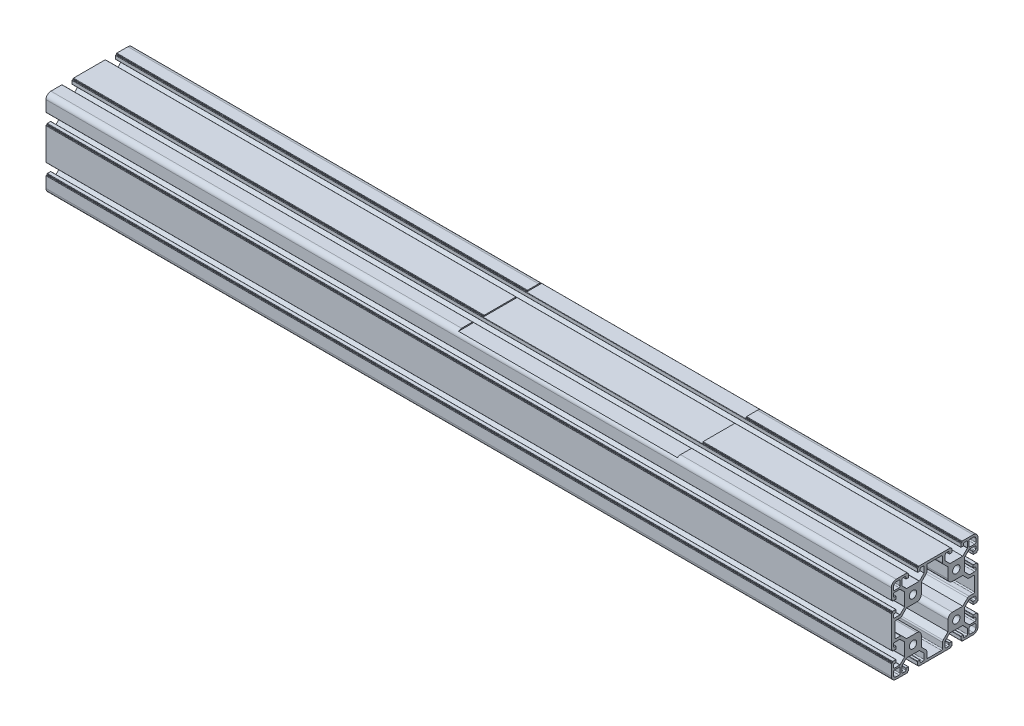
from build123d import *

# Parameters (mm, degrees)
SKETCH_19_R                = 3.4
GB_T5237_2004_8080_1_DEPTH = 780
SKETCH_20_W                = 202
SKETCH_20_H                = 80
CUT_EXTRUDE_1_DEPTH        = 1
SKETCH_21_R                = 12.5
CUT_EXTRUDE_2_DEPTH        = 35
CUT_EXTRUDE_3_DEPTH        = 30


with BuildPart() as part:
    # 草图19 → 铝型材（gb t5237-2004） 8080(1) (new body)
    with BuildSketch(Plane.YZ):
        with BuildLine():
            Line((-25.807968978, -27.7), (-14.192031022, -27.7))
            ThreePointArc((-14.192031022, -27.7), (-14.077225992, -27.72283614), (-13.979898987, -27.787867966))
            Line((-13.979898987, -27.787867966), (-9.837867966, -31.929898987))
            ThreePointArc((-9.837867966, -31.929898987), (-9.77283614, -32.027225992), (-9.75, -32.142031022))
            Line((-9.75, -32.142031022), (-9.75, -37))
            ThreePointArc((-9.75, -37), (-10.042893219, -37.707106781), (-10.75, -38))
            Line((-10.75, -38), (-12.4, -38))
            ThreePointArc((-12.4, -38), (-13.107106781, -37.707106781), (-13.4, -37))
            Line((-13.4, -37), (-13.4, -35.8))
            ThreePointArc((-13.4, -35.8), (-13.487867966, -35.587867966), (-13.7, -35.5))
            Line((-13.7, -35.5), (-15.6, -35.5))
            ThreePointArc((-15.6, -35.5), (-15.812132034, -35.587867966), (-15.9, -35.8))
            Line((-15.9, -35.8), (-15.9, -38.7))
            ThreePointArc((-15.9, -38.7), (-15.812132034, -38.912132034), (-15.6, -39))
            Line((-15.6, -39), (-15.1, -39))
            ThreePointArc((-15.1, -39), (-14.958578644, -39.058578644), (-14.9, -39.2))
            Line((-14.9, -39.2), (-14.9, -39.7))
            ThreePointArc((-14.9, -39.7), (-14.812132034, -39.912132034), (-14.6, -40))
            Line((-14.6, -40), (14.6, -40))
            ThreePointArc((14.6, -40), (14.812132034, -39.912132034), (14.9, -39.7))
            Line((14.9, -39.7), (14.9, -39.2))
            ThreePointArc((14.9, -39.2), (14.958578644, -39.058578644), (15.1, -39))
            Line((15.1, -39), (15.6, -39))
            ThreePointArc((15.6, -39), (15.812132034, -38.912132034), (15.9, -38.7))
            Line((15.9, -38.7), (15.9, -35.8))
            ThreePointArc((15.9, -35.8), (15.812132034, -35.587867966), (15.6, -35.5))
            Line((15.6, -35.5), (13.7, -35.5))
            ThreePointArc((13.7, -35.5), (13.487867966, -35.587867966), (13.4, -35.8))
            Line((13.4, -35.8), (13.4, -37))
            ThreePointArc((13.4, -37), (13.107106781, -37.707106781), (12.4, -38))
            Line((12.4, -38), (10.75, -38))
            ThreePointArc((10.75, -38), (10.042893219, -37.707106781), (9.75, -37))
            Line((9.75, -37), (9.75, -32.142031022))
            ThreePointArc((9.75, -32.142031022), (9.77283614, -32.027225992), (9.837867966, -31.929898987))
            Line((9.837867966, -31.929898987), (13.979898987, -27.787867966))
            ThreePointArc((13.979898987, -27.787867966), (14.077225992, -27.72283614), (14.192031022, -27.7))
            Line((14.192031022, -27.7), (25.807968978, -27.7))
            ThreePointArc((25.807968978, -27.7), (25.922774008, -27.72283614), (26.020101013, -27.787867966))
            Line((26.020101013, -27.787867966), (30.162132034, -31.929898987))
            ThreePointArc((30.162132034, -31.929898987), (30.22716386, -32.027225992), (30.25, -32.142031022))
            Line((30.25, -32.142031022), (30.25, -37))
            ThreePointArc((30.25, -37), (29.957106781, -37.707106781), (29.25, -38))
            Line((29.25, -38), (27.6, -38))
            ThreePointArc((27.6, -38), (26.892893219, -37.707106781), (26.6, -37))
            Line((26.6, -37), (26.6, -35.8))
            ThreePointArc((26.6, -35.8), (26.512132034, -35.587867966), (26.3, -35.5))
            Line((26.3, -35.5), (24.4, -35.5))
            ThreePointArc((24.4, -35.5), (24.187867966, -35.587867966), (24.1, -35.8))
            Line((24.1, -35.8), (24.1, -38.7))
            ThreePointArc((24.1, -38.7), (24.187867966, -38.912132034), (24.4, -39))
            Line((24.4, -39), (24.9, -39))
            ThreePointArc((24.9, -39), (25.041421356, -39.058578644), (25.1, -39.2))
            Line((25.1, -39.2), (25.1, -39.7))
            ThreePointArc((25.1, -39.7), (25.187867966, -39.912132034), (25.4, -40))
            Line((25.4, -40), (35.5, -40))
            ThreePointArc((35.5, -40), (38.681980515, -38.681980515), (40, -35.5))
            Line((40, -35.5), (40, -25.4))
            ThreePointArc((40, -25.4), (39.912132034, -25.187867966), (39.7, -25.1))
            Line((39.7, -25.1), (39.2, -25.1))
            ThreePointArc((39.2, -25.1), (39.058578644, -25.041421356), (39, -24.9))
            Line((39, -24.9), (39, -24.4))
            ThreePointArc((39, -24.4), (38.912132034, -24.187867966), (38.7, -24.1))
            Line((38.7, -24.1), (35.8, -24.1))
            ThreePointArc((35.8, -24.1), (35.587867966, -24.187867966), (35.5, -24.4))
            Line((35.5, -24.4), (35.5, -26.3))
            ThreePointArc((35.5, -26.3), (35.587867966, -26.512132034), (35.8, -26.6))
            Line((35.8, -26.6), (37, -26.6))
            ThreePointArc((37, -26.6), (37.707106781, -26.892893219), (38, -27.6))
            Line((38, -27.6), (38, -29.25))
            ThreePointArc((38, -29.25), (37.707106781, -29.957106781), (37, -30.25))
            Line((37, -30.25), (32.142031022, -30.25))
            ThreePointArc((32.142031022, -30.25), (32.027225992, -30.22716386), (31.929898987, -30.162132034))
            Line((31.929898987, -30.162132034), (27.7, -25.932233047))
            Line((27.7, -25.932233047), (27.7, -14.067766953))
            Line((27.7, -14.067766953), (32.017766953, -9.75))
            Line((32.017766953, -9.75), (37, -9.75))
            ThreePointArc((37, -9.75), (37.707106781, -10.042893219), (38, -10.75))
            Line((38, -10.75), (38, -12.4))
            ThreePointArc((38, -12.4), (37.707106781, -13.107106781), (37, -13.4))
            Line((37, -13.4), (35.8, -13.4))
            ThreePointArc((35.8, -13.4), (35.587867966, -13.487867966), (35.5, -13.7))
            Line((35.5, -13.7), (35.5, -15.6))
            ThreePointArc((35.5, -15.6), (35.587867966, -15.812132034), (35.8, -15.9))
            Line((35.8, -15.9), (38.7, -15.9))
            ThreePointArc((38.7, -15.9), (38.912132034, -15.812132034), (39, -15.6))
            Line((39, -15.6), (39, -15.1))
            ThreePointArc((39, -15.1), (39.058578644, -14.958578644), (39.2, -14.9))
            Line((39.2, -14.9), (39.7, -14.9))
            ThreePointArc((39.7, -14.9), (39.912132034, -14.812132034), (40, -14.6))
            Line((40, -14.6), (40, 14.6))
            ThreePointArc((40, 14.6), (39.912132034, 14.812132034), (39.7, 14.9))
            Line((39.7, 14.9), (39.2, 14.9))
            ThreePointArc((39.2, 14.9), (39.058578644, 14.958578644), (39, 15.1))
            Line((39, 15.1), (39, 15.6))
            ThreePointArc((39, 15.6), (38.912132034, 15.812132034), (38.7, 15.9))
            Line((38.7, 15.9), (35.8, 15.9))
            ThreePointArc((35.8, 15.9), (35.587867966, 15.812132034), (35.5, 15.6))
            Line((35.5, 15.6), (35.5, 13.7))
            ThreePointArc((35.5, 13.7), (35.587867966, 13.487867966), (35.8, 13.4))
            Line((35.8, 13.4), (37, 13.4))
            ThreePointArc((37, 13.4), (37.707106781, 13.107106781), (38, 12.4))
            Line((38, 12.4), (38, 10.75))
            ThreePointArc((38, 10.75), (37.707106781, 10.042893219), (37, 9.75))
            Line((37, 9.75), (32.017766953, 9.75))
            Line((32.017766953, 9.75), (27.787867966, 13.979898987))
            ThreePointArc((27.787867966, 13.979898987), (27.72283614, 14.077225992), (27.7, 14.192031022))
            Line((27.7, 14.192031022), (27.7, 25.807968978))
            ThreePointArc((27.7, 25.807968978), (27.72283614, 25.922774008), (27.787867966, 26.020101013))
            Line((27.787867966, 26.020101013), (31.929898987, 30.162132034))
            ThreePointArc((31.929898987, 30.162132034), (32.027225992, 30.22716386), (32.142031022, 30.25))
            Line((32.142031022, 30.25), (37, 30.25))
            ThreePointArc((37, 30.25), (37.707106781, 29.957106781), (38, 29.25))
            Line((38, 29.25), (38, 27.6))
            ThreePointArc((38, 27.6), (37.707106781, 26.892893219), (37, 26.6))
            Line((37, 26.6), (35.8, 26.6))
            ThreePointArc((35.8, 26.6), (35.587867966, 26.512132034), (35.5, 26.3))
            Line((35.5, 26.3), (35.5, 24.4))
            ThreePointArc((35.5, 24.4), (35.587867966, 24.187867966), (35.8, 24.1))
            Line((35.8, 24.1), (38.7, 24.1))
            ThreePointArc((38.7, 24.1), (38.912132034, 24.187867966), (39, 24.4))
            Line((39, 24.4), (39, 24.9))
            ThreePointArc((39, 24.9), (39.058578644, 25.041421356), (39.2, 25.1))
            Line((39.2, 25.1), (39.7, 25.1))
            ThreePointArc((39.7, 25.1), (39.912132034, 25.187867966), (40, 25.4))
            Line((40, 25.4), (40, 35.5))
            ThreePointArc((40, 35.5), (38.681980515, 38.681980515), (35.5, 40))
            Line((35.5, 40), (25.4, 40))
            ThreePointArc((25.4, 40), (25.187867966, 39.912132034), (25.1, 39.7))
            Line((25.1, 39.7), (25.1, 39.2))
            ThreePointArc((25.1, 39.2), (25.041421356, 39.058578644), (24.9, 39))
            Line((24.9, 39), (24.4, 39))
            ThreePointArc((24.4, 39), (24.187867966, 38.912132034), (24.1, 38.7))
            Line((24.1, 38.7), (24.1, 35.8))
            ThreePointArc((24.1, 35.8), (24.187867966, 35.587867966), (24.4, 35.5))
            Line((24.4, 35.5), (26.3, 35.5))
            ThreePointArc((26.3, 35.5), (26.512132034, 35.587867966), (26.6, 35.8))
            Line((26.6, 35.8), (26.6, 37))
            ThreePointArc((26.6, 37), (26.892893219, 37.707106781), (27.6, 38))
            Line((27.6, 38), (29.25, 38))
            ThreePointArc((29.25, 38), (29.957106781, 37.707106781), (30.25, 37))
            Line((30.25, 37), (30.25, 32.142031022))
            ThreePointArc((30.25, 32.142031022), (30.22716386, 32.027225992), (30.162132034, 31.929898987))
            Line((30.162132034, 31.929898987), (26.020101013, 27.787867966))
            ThreePointArc((26.020101013, 27.787867966), (25.922774008, 27.72283614), (25.807968978, 27.7))
            Line((25.807968978, 27.7), (14.192031022, 27.7))
            ThreePointArc((14.192031022, 27.7), (14.077225992, 27.72283614), (13.979898987, 27.787867966))
            Line((13.979898987, 27.787867966), (9.837867966, 31.929898987))
            ThreePointArc((9.837867966, 31.929898987), (9.77283614, 32.027225992), (9.75, 32.142031022))
            Line((9.75, 32.142031022), (9.75, 37))
            ThreePointArc((9.75, 37), (10.042893219, 37.707106781), (10.75, 38))
            Line((10.75, 38), (12.4, 38))
            ThreePointArc((12.4, 38), (13.107106781, 37.707106781), (13.4, 37))
            Line((13.4, 37), (13.4, 35.8))
            ThreePointArc((13.4, 35.8), (13.487867966, 35.587867966), (13.7, 35.5))
            Line((13.7, 35.5), (15.6, 35.5))
            ThreePointArc((15.6, 35.5), (15.812132034, 35.587867966), (15.9, 35.8))
            Line((15.9, 35.8), (15.9, 38.7))
            ThreePointArc((15.9, 38.7), (15.812132034, 38.912132034), (15.6, 39))
            Line((15.6, 39), (15.1, 39))
            ThreePointArc((15.1, 39), (14.958578644, 39.058578644), (14.9, 39.2))
            Line((14.9, 39.2), (14.9, 39.7))
            ThreePointArc((14.9, 39.7), (14.812132034, 39.912132034), (14.6, 40))
            Line((14.6, 40), (-14.6, 40))
            ThreePointArc((-14.6, 40), (-14.812132034, 39.912132034), (-14.9, 39.7))
            Line((-14.9, 39.7), (-14.9, 39.2))
            ThreePointArc((-14.9, 39.2), (-14.958578644, 39.058578644), (-15.1, 39))
            Line((-15.1, 39), (-15.6, 39))
            ThreePointArc((-15.6, 39), (-15.812132034, 38.912132034), (-15.9, 38.7))
            Line((-15.9, 38.7), (-15.9, 35.8))
            ThreePointArc((-15.9, 35.8), (-15.812132034, 35.587867966), (-15.6, 35.5))
            Line((-15.6, 35.5), (-13.7, 35.5))
            ThreePointArc((-13.7, 35.5), (-13.487867966, 35.587867966), (-13.4, 35.8))
            Line((-13.4, 35.8), (-13.4, 37))
            ThreePointArc((-13.4, 37), (-13.107106781, 37.707106781), (-12.4, 38))
            Line((-12.4, 38), (-10.75, 38))
            ThreePointArc((-10.75, 38), (-10.042893219, 37.707106781), (-9.75, 37))
            Line((-9.75, 37), (-9.75, 32.142031022))
            ThreePointArc((-9.75, 32.142031022), (-9.77283614, 32.027225992), (-9.837867966, 31.929898987))
            Line((-9.837867966, 31.929898987), (-13.979898987, 27.787867966))
            ThreePointArc((-13.979898987, 27.787867966), (-14.077225992, 27.72283614), (-14.192031022, 27.7))
            Line((-14.192031022, 27.7), (-25.807968978, 27.7))
            ThreePointArc((-25.807968978, 27.7), (-25.922774008, 27.72283614), (-26.020101013, 27.787867966))
            Line((-26.020101013, 27.787867966), (-30.162132034, 31.929898987))
            ThreePointArc((-30.162132034, 31.929898987), (-30.22716386, 32.027225992), (-30.25, 32.142031022))
            Line((-30.25, 32.142031022), (-30.25, 37))
            ThreePointArc((-30.25, 37), (-29.957106781, 37.707106781), (-29.25, 38))
            Line((-29.25, 38), (-27.6, 38))
            ThreePointArc((-27.6, 38), (-26.892893219, 37.707106781), (-26.6, 37))
            Line((-26.6, 37), (-26.6, 35.8))
            ThreePointArc((-26.6, 35.8), (-26.512132034, 35.587867966), (-26.3, 35.5))
            Line((-26.3, 35.5), (-24.4, 35.5))
            ThreePointArc((-24.4, 35.5), (-24.187867966, 35.587867966), (-24.1, 35.8))
            Line((-24.1, 35.8), (-24.1, 38.7))
            ThreePointArc((-24.1, 38.7), (-24.187867966, 38.912132034), (-24.4, 39))
            Line((-24.4, 39), (-24.9, 39))
            ThreePointArc((-24.9, 39), (-25.041421356, 39.058578644), (-25.1, 39.2))
            Line((-25.1, 39.2), (-25.1, 39.7))
            ThreePointArc((-25.1, 39.7), (-25.187867966, 39.912132034), (-25.4, 40))
            Line((-25.4, 40), (-35.5, 40))
            ThreePointArc((-35.5, 40), (-38.681980515, 38.681980515), (-40, 35.5))
            Line((-40, 35.5), (-40, 25.4))
            ThreePointArc((-40, 25.4), (-39.912132034, 25.187867966), (-39.7, 25.1))
            Line((-39.7, 25.1), (-39.2, 25.1))
            ThreePointArc((-39.2, 25.1), (-39.058578644, 25.041421356), (-39, 24.9))
            Line((-39, 24.9), (-39, 24.4))
            ThreePointArc((-39, 24.4), (-38.912132034, 24.187867966), (-38.7, 24.1))
            Line((-38.7, 24.1), (-35.8, 24.1))
            ThreePointArc((-35.8, 24.1), (-35.587867966, 24.187867966), (-35.5, 24.4))
            Line((-35.5, 24.4), (-35.5, 26.3))
            ThreePointArc((-35.5, 26.3), (-35.587867966, 26.512132034), (-35.8, 26.6))
            Line((-35.8, 26.6), (-37, 26.6))
            ThreePointArc((-37, 26.6), (-37.707106781, 26.892893219), (-38, 27.6))
            Line((-38, 27.6), (-38, 29.25))
            ThreePointArc((-38, 29.25), (-37.707106781, 29.957106781), (-37, 30.25))
            Line((-37, 30.25), (-32.142031022, 30.25))
            ThreePointArc((-32.142031022, 30.25), (-32.027225992, 30.22716386), (-31.929898987, 30.162132034))
            Line((-31.929898987, 30.162132034), (-27.787867966, 26.020101013))
            ThreePointArc((-27.787867966, 26.020101013), (-27.72283614, 25.922774008), (-27.7, 25.807968978))
            Line((-27.7, 25.807968978), (-27.7, 14.192031022))
            ThreePointArc((-27.7, 14.192031022), (-27.72283614, 14.077225992), (-27.787867966, 13.979898987))
            Line((-27.787867966, 13.979898987), (-32.017766953, 9.75))
            Line((-32.017766953, 9.75), (-37, 9.75))
            ThreePointArc((-37, 9.75), (-37.707106781, 10.042893219), (-38, 10.75))
            Line((-38, 10.75), (-38, 12.4))
            ThreePointArc((-38, 12.4), (-37.707106781, 13.107106781), (-37, 13.4))
            Line((-37, 13.4), (-35.8, 13.4))
            ThreePointArc((-35.8, 13.4), (-35.587867966, 13.487867966), (-35.5, 13.7))
            Line((-35.5, 13.7), (-35.5, 15.6))
            ThreePointArc((-35.5, 15.6), (-35.587867966, 15.812132034), (-35.8, 15.9))
            Line((-35.8, 15.9), (-38.7, 15.9))
            ThreePointArc((-38.7, 15.9), (-38.912132034, 15.812132034), (-39, 15.6))
            Line((-39, 15.6), (-39, 15.1))
            ThreePointArc((-39, 15.1), (-39.058578644, 14.958578644), (-39.2, 14.9))
            Line((-39.2, 14.9), (-39.7, 14.9))
            ThreePointArc((-39.7, 14.9), (-39.912132034, 14.812132034), (-40, 14.6))
            Line((-40, 14.6), (-40, -14.6))
            ThreePointArc((-40, -14.6), (-39.912132034, -14.812132034), (-39.7, -14.9))
            Line((-39.7, -14.9), (-39.2, -14.9))
            ThreePointArc((-39.2, -14.9), (-39.058578644, -14.958578644), (-39, -15.1))
            Line((-39, -15.1), (-39, -15.6))
            ThreePointArc((-39, -15.6), (-38.912132034, -15.812132034), (-38.7, -15.9))
            Line((-38.7, -15.9), (-35.8, -15.9))
            ThreePointArc((-35.8, -15.9), (-35.587867966, -15.812132034), (-35.5, -15.6))
            Line((-35.5, -15.6), (-35.5, -13.7))
            ThreePointArc((-35.5, -13.7), (-35.587867966, -13.487867966), (-35.8, -13.4))
            Line((-35.8, -13.4), (-37, -13.4))
            ThreePointArc((-37, -13.4), (-37.707106781, -13.107106781), (-38, -12.4))
            Line((-38, -12.4), (-38, -10.75))
            ThreePointArc((-38, -10.75), (-37.707106781, -10.042893219), (-37, -9.75))
            Line((-37, -9.75), (-32.017766953, -9.75))
            Line((-32.017766953, -9.75), (-27.787867966, -13.979898987))
            ThreePointArc((-27.787867966, -13.979898987), (-27.72283614, -14.077225992), (-27.7, -14.192031022))
            Line((-27.7, -14.192031022), (-27.7, -25.807968978))
            ThreePointArc((-27.7, -25.807968978), (-27.72283614, -25.922774008), (-27.787867966, -26.020101013))
            Line((-27.787867966, -26.020101013), (-31.929898987, -30.162132034))
            ThreePointArc((-31.929898987, -30.162132034), (-32.027225992, -30.22716386), (-32.142031022, -30.25))
            Line((-32.142031022, -30.25), (-37, -30.25))
            ThreePointArc((-37, -30.25), (-37.707106781, -29.957106781), (-38, -29.25))
            Line((-38, -29.25), (-38, -27.6))
            ThreePointArc((-38, -27.6), (-37.707106781, -26.892893219), (-37, -26.6))
            Line((-37, -26.6), (-35.8, -26.6))
            ThreePointArc((-35.8, -26.6), (-35.587867966, -26.512132034), (-35.5, -26.3))
            Line((-35.5, -26.3), (-35.5, -24.4))
            ThreePointArc((-35.5, -24.4), (-35.587867966, -24.187867966), (-35.8, -24.1))
            Line((-35.8, -24.1), (-38.7, -24.1))
            ThreePointArc((-38.7, -24.1), (-38.912132034, -24.187867966), (-39, -24.4))
            Line((-39, -24.4), (-39, -24.9))
            ThreePointArc((-39, -24.9), (-39.058578644, -25.041421356), (-39.2, -25.1))
            Line((-39.2, -25.1), (-39.7, -25.1))
            ThreePointArc((-39.7, -25.1), (-39.912132034, -25.187867966), (-40, -25.4))
            Line((-40, -25.4), (-40, -35.5))
            ThreePointArc((-40, -35.5), (-38.681980515, -38.681980515), (-35.5, -40))
            Line((-35.5, -40), (-25.4, -40))
            ThreePointArc((-25.4, -40), (-25.187867966, -39.912132034), (-25.1, -39.7))
            Line((-25.1, -39.7), (-25.1, -39.2))
            ThreePointArc((-25.1, -39.2), (-25.041421356, -39.058578644), (-24.9, -39))
            Line((-24.9, -39), (-24.4, -39))
            ThreePointArc((-24.4, -39), (-24.187867966, -38.912132034), (-24.1, -38.7))
            Line((-24.1, -38.7), (-24.1, -35.8))
            ThreePointArc((-24.1, -35.8), (-24.187867966, -35.587867966), (-24.4, -35.5))
            Line((-24.4, -35.5), (-26.3, -35.5))
            ThreePointArc((-26.3, -35.5), (-26.512132034, -35.587867966), (-26.6, -35.8))
            Line((-26.6, -35.8), (-26.6, -37))
            ThreePointArc((-26.6, -37), (-26.892893219, -37.707106781), (-27.6, -38))
            Line((-27.6, -38), (-29.25, -38))
            ThreePointArc((-29.25, -38), (-29.957106781, -37.707106781), (-30.25, -37))
            Line((-30.25, -37), (-30.25, -32.142031022))
            ThreePointArc((-30.25, -32.142031022), (-30.22716386, -32.027225992), (-30.162132034, -31.929898987))
            Line((-30.162132034, -31.929898987), (-26.020101013, -27.787867966))
            ThreePointArc((-26.020101013, -27.787867966), (-25.922774008, -27.72283614), (-25.807968978, -27.7))
        make_face()
        with Locations((20, -20)):
            Circle(SKETCH_19_R, mode=Mode.SUBTRACT)
        with Locations((-20, -20)):
            Circle(SKETCH_19_R, mode=Mode.SUBTRACT)
        with Locations((-20, 20)):
            Circle(SKETCH_19_R, mode=Mode.SUBTRACT)
        with Locations((20, 20)):
            Circle(SKETCH_19_R, mode=Mode.SUBTRACT)
        with BuildLine():
            Line((31.810660172, 7.25), (36.8, 7.25))
            ThreePointArc((36.8, 7.25), (37.507106781, 6.957106781), (37.8, 6.25))
            Line((37.8, 6.25), (37.8, -6.25))
            ThreePointArc((37.8, -6.25), (37.507106781, -6.957106781), (36.8, -7.25))
            Line((36.8, -7.25), (31.810660172, -7.25))
            ThreePointArc((31.810660172, -7.25), (31.045293307, -7.402240935), (30.396446609, -7.835786438))
            Line((30.396446609, -7.835786438), (25.932233047, -12.3))
            Line((25.932233047, -12.3), (16.3, -12.3))
            ThreePointArc((16.3, -12.3), (13.471572875, -13.471572875), (12.3, -16.3))
            Line((12.3, -16.3), (12.3, -25.932233047))
            Line((12.3, -25.932233047), (7.835786438, -30.396446609))
            ThreePointArc((7.835786438, -30.396446609), (7.402240935, -31.045293307), (7.25, -31.810660172))
            Line((7.25, -31.810660172), (7.25, -35.8))
            ThreePointArc((7.25, -35.8), (6.957106781, -36.507106781), (6.25, -36.8))
            Line((6.25, -36.8), (-6.25, -36.8))
            ThreePointArc((-6.25, -36.8), (-6.957106781, -36.507106781), (-7.25, -35.8))
            Line((-7.25, -35.8), (-7.25, -31.810660172))
            ThreePointArc((-7.25, -31.810660172), (-7.402240935, -31.045293307), (-7.835786438, -30.396446609))
            Line((-7.835786438, -30.396446609), (-12.3, -25.932233047))
            Line((-12.3, -25.932233047), (-12.3, -16.3))
            ThreePointArc((-12.3, -16.3), (-13.471572875, -13.471572875), (-16.3, -12.3))
            Line((-16.3, -12.3), (-25.932233047, -12.3))
            Line((-25.932233047, -12.3), (-30.396446609, -7.835786438))
            ThreePointArc((-30.396446609, -7.835786438), (-31.045293307, -7.402240935), (-31.810660172, -7.25))
            Line((-31.810660172, -7.25), (-36.8, -7.25))
            ThreePointArc((-36.8, -7.25), (-37.507106781, -6.957106781), (-37.8, -6.25))
            Line((-37.8, -6.25), (-37.8, 6.25))
            ThreePointArc((-37.8, 6.25), (-37.507106781, 6.957106781), (-36.8, 7.25))
            Line((-36.8, 7.25), (-31.810660172, 7.25))
            ThreePointArc((-31.810660172, 7.25), (-31.045293307, 7.402240935), (-30.396446609, 7.835786438))
            Line((-30.396446609, 7.835786438), (-25.932233047, 12.3))
            Line((-25.932233047, 12.3), (-16.3, 12.3))
            ThreePointArc((-16.3, 12.3), (-13.471572875, 13.471572875), (-12.3, 16.3))
            Line((-12.3, 16.3), (-12.3, 25.932233047))
            Line((-12.3, 25.932233047), (-7.835786438, 30.396446609))
            ThreePointArc((-7.835786438, 30.396446609), (-7.402240935, 31.045293307), (-7.25, 31.810660172))
            Line((-7.25, 31.810660172), (-7.25, 35.8))
            ThreePointArc((-7.25, 35.8), (-6.957106781, 36.507106781), (-6.25, 36.8))
            Line((-6.25, 36.8), (6.25, 36.8))
            ThreePointArc((6.25, 36.8), (6.957106781, 36.507106781), (7.25, 35.8))
            Line((7.25, 35.8), (7.25, 31.810660172))
            ThreePointArc((7.25, 31.810660172), (7.402240935, 31.045293307), (7.835786438, 30.396446609))
            Line((7.835786438, 30.396446609), (12.3, 25.932233047))
            Line((12.3, 25.932233047), (12.3, 16.3))
            ThreePointArc((12.3, 16.3), (13.471572875, 13.471572875), (16.3, 12.3))
            Line((16.3, 12.3), (25.932233047, 12.3))
            Line((25.932233047, 12.3), (30.396446609, 7.835786438))
            ThreePointArc((30.396446609, 7.835786438), (31.045293307, 7.402240935), (31.810660172, 7.25))
        make_face(mode=Mode.SUBTRACT)
        with BuildLine():
            Line((38, 35.5), (38, 32.75))
            ThreePointArc((38, 32.75), (37.707106781, 32.042893219), (37, 31.75))
            Line((37, 31.75), (32.75, 31.75))
            ThreePointArc((32.75, 31.75), (32.042893219, 32.042893219), (31.75, 32.75))
            Line((31.75, 32.75), (31.75, 37))
            ThreePointArc((31.75, 37), (32.042893219, 37.707106781), (32.75, 38))
            Line((32.75, 38), (35.5, 38))
            ThreePointArc((35.5, 38), (37.267766953, 37.267766953), (38, 35.5))
        make_face(mode=Mode.SUBTRACT)
        with BuildLine():
            Line((-35.5, 38), (-32.75, 38))
            ThreePointArc((-32.75, 38), (-32.042893219, 37.707106781), (-31.75, 37))
            Line((-31.75, 37), (-31.75, 32.75))
            ThreePointArc((-31.75, 32.75), (-32.042893219, 32.042893219), (-32.75, 31.75))
            Line((-32.75, 31.75), (-37, 31.75))
            ThreePointArc((-37, 31.75), (-37.707106781, 32.042893219), (-38, 32.75))
            Line((-38, 32.75), (-38, 35.5))
            ThreePointArc((-38, 35.5), (-37.267766953, 37.267766953), (-35.5, 38))
        make_face(mode=Mode.SUBTRACT)
        with BuildLine():
            Line((-38, -35.5), (-38, -32.75))
            ThreePointArc((-38, -32.75), (-37.707106781, -32.042893219), (-37, -31.75))
            Line((-37, -31.75), (-32.75, -31.75))
            ThreePointArc((-32.75, -31.75), (-32.042893219, -32.042893219), (-31.75, -32.75))
            Line((-31.75, -32.75), (-31.75, -37))
            ThreePointArc((-31.75, -37), (-32.042893219, -37.707106781), (-32.75, -38))
            Line((-32.75, -38), (-35.5, -38))
            ThreePointArc((-35.5, -38), (-37.267766953, -37.267766953), (-38, -35.5))
        make_face(mode=Mode.SUBTRACT)
        with BuildLine():
            Line((35.5, -38), (32.75, -38))
            ThreePointArc((32.75, -38), (32.042893219, -37.707106781), (31.75, -37))
            Line((31.75, -37), (31.75, -32.75))
            ThreePointArc((31.75, -32.75), (32.042893219, -32.042893219), (32.75, -31.75))
            Line((32.75, -31.75), (37, -31.75))
            ThreePointArc((37, -31.75), (37.707106781, -32.042893219), (38, -32.75))
            Line((38, -32.75), (38, -35.5))
            ThreePointArc((38, -35.5), (37.267766953, -37.267766953), (35.5, -38))
        make_face(mode=Mode.SUBTRACT)
    extrude(amount=GB_T5237_2004_8080_1_DEPTH)

    # 草图20 → 切除-拉伸1 (cut)
    with BuildSketch(Plane(origin=(0, 40, 0), x_dir=(1, 0, 0), z_dir=(0, 1, 0))):
        with Locations((480, 0)):
            Rectangle(SKETCH_20_W, SKETCH_20_H)
    extrude(amount=-CUT_EXTRUDE_1_DEPTH, mode=Mode.SUBTRACT)

    # 草图21 → 切除-拉伸2 (cut)
    with BuildSketch(Plane.XZ.offset(40)):
        with Locations(Location((323, 0, 0), (0, 0, 270))):
            Circle(SKETCH_21_R)
        with Locations(Location((222.980395003, 0.670705331, 0), (0, 0, 270))):
            Circle(SKETCH_21_R)
    extrude(amount=-CUT_EXTRUDE_2_DEPTH, mode=Mode.SUBTRACT)

    # 草图22 → 切除-拉伸3 (cut)
    with BuildSketch(Plane.XZ.offset(40)):
        with BuildLine():
            Line((460, 12.5), (560, 12.5))
            ThreePointArc((560, 12.5), (572.5, 0), (560, -12.5))
            Line((560, -12.5), (460, -12.5))
            ThreePointArc((460, -12.5), (447.5, 0), (460, 12.5))
        make_face()
    extrude(amount=-CUT_EXTRUDE_3_DEPTH, mode=Mode.SUBTRACT)


solid = part.part
